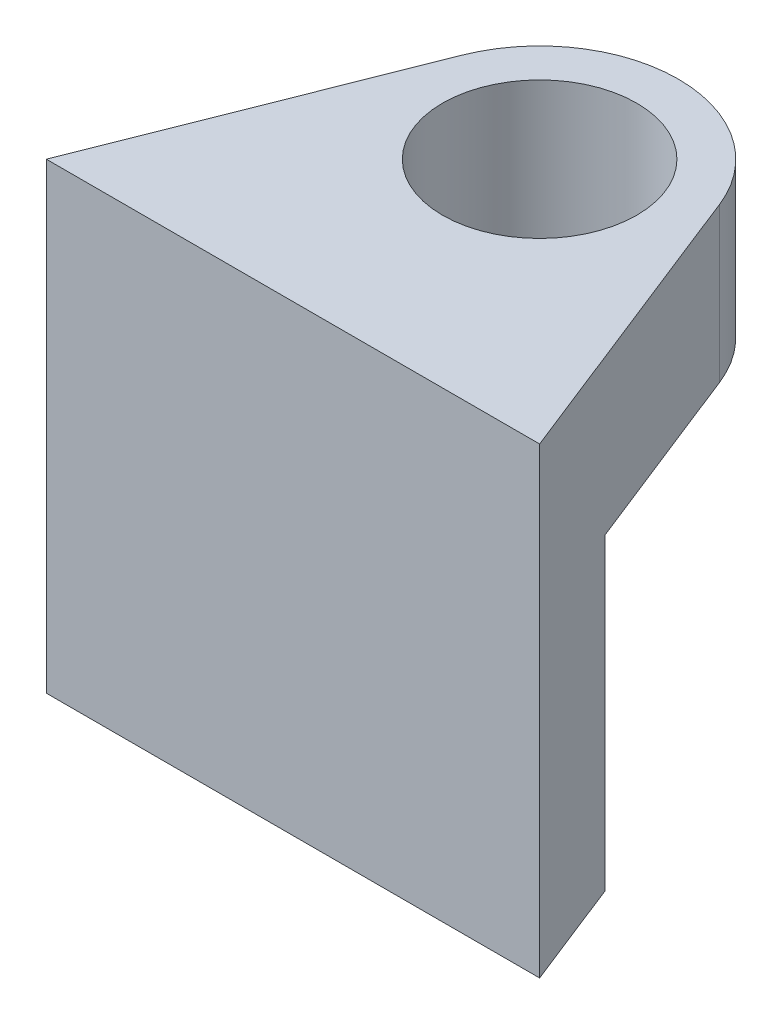
from build123d import *

# Parameters (mm, degrees)
SKETCH2_R           = 3.15
BOSS_EXTRUDE1_DEPTH = 5
BOSS_EXTRUDE3_DEPTH = 10


with BuildPart() as part:
    # Sketch2 → Boss-Extrude1 (new body)
    with BuildSketch(Plane(origin=(0, 0, 0), x_dir=(1, 0, 0), z_dir=(0, 1, 0))):
        with BuildLine():
            Line((-8, -8), (8, -8))
            Line((8, -8), (4.185075866, 1.653825866))
            ThreePointArc((4.185075866, 1.653825866), (0, 4.5), (-4.185075866, 1.653825866))
            Line((-4.185075866, 1.653825866), (-8, -8))
        make_face()
        Circle(SKETCH2_R, mode=Mode.SUBTRACT)
    extrude(amount=BOSS_EXTRUDE1_DEPTH)

    # Sketch3 → Boss-Extrude3 (add)
    with BuildSketch(Plane.XZ):
        Polygon((8, 8), (6.616897109, 4.5), (-6.616897109, 4.5), (-8, 8), align=None)
    extrude(amount=BOSS_EXTRUDE3_DEPTH)


solid = part.part
